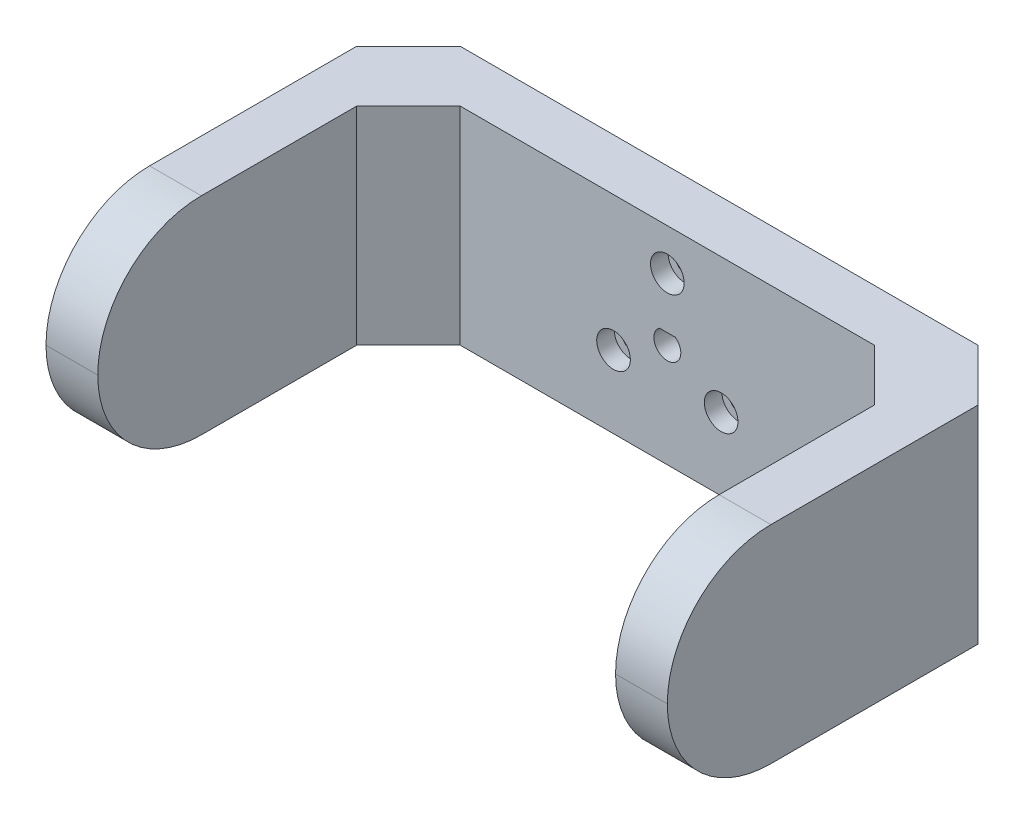
from build123d import *

# Parameters (mm, degrees)
AUFSATZ_LINEAR_AUSTRAGEN1_DEPTH = 20
SCHNITT_LINEAR_AUSTRAGEN1_DEPTH = 20
FASE1_SIZE                      = 10
VERRUNDUNG1_R                   = 20
SKIZZE3_R                       = 3.25
SCHNITT_LINEAR_AUSTRAGEN2_DEPTH = 3.4
SKIZZE4_R                       = 1.7
SCHNITT_LINEAR_AUSTRAGEN3_DEPTH = 6.6
KREISMUSTER1_COUNT              = 3


with BuildPart() as part:
    # Skizze1 → Aufsatz-Linear austragen1 (new, symmetric)
    with BuildSketch(Plane(origin=(0, 0, 0), x_dir=(1, 0, 0), z_dir=(0, 1, 0))):
        Polygon((-60, 0), (60, 0), (60, -70), (50, -70), (50, -10), (-50, -10), (-50, -70), (-60, -70), align=None)
    extrude(amount=AUFSATZ_LINEAR_AUSTRAGEN1_DEPTH, both=True)

    # Skizze2 → Schnitt-Linear austragen1 (cut)
    with BuildSketch(Plane(origin=(0, 0, 0), x_dir=(-1, 0, 0), z_dir=(0, 0, -1))):
        with BuildLine():
            Line((-1.532970972, 2.1), (1.532970972, 2.1))
            ThreePointArc((1.532970972, 2.1), (0, -2.6), (-1.532970972, 2.1))
        make_face()
    extrude(amount=-SCHNITT_LINEAR_AUSTRAGEN1_DEPTH, mode=Mode.SUBTRACT)

    # Fase1
    fase1_edges = [part.edges().sort_by_distance(p)[0] for p in [
        (-60, 0, 0),
        (60, 0, 0),
        (50, 0, 10),
        (-50, 0, 10),
    ]]
    chamfer(fase1_edges, length=FASE1_SIZE)

    # Verrundung1
    verrundung1_edges = [part.edges().sort_by_distance(p)[0] for p in [
        (-55, -20, 70),
        (-55, 20, 70),
        (55, 20, 70),
        (55, -20, 70),
    ]]
    fillet(verrundung1_edges, radius=VERRUNDUNG1_R - 0.0001)  # a hair under: the kernel refuses the full size

    # Skizze3 → Schnitt-Linear austragen2 (cut)
    with BuildSketch(Plane.XY.offset(10)):
        with Locations((0, 12)):
            Circle(SKIZZE3_R)
    schnitt_linear_austragen2 = extrude(amount=-SCHNITT_LINEAR_AUSTRAGEN2_DEPTH, mode=Mode.SUBTRACT)

    # Skizze4 → Schnitt-Linear austragen3 (cut)
    with BuildSketch(Plane.XY.offset(6.6)):
        with Locations((0, 12)):
            Circle(SKIZZE4_R)
    schnitt_linear_austragen3 = extrude(amount=-SCHNITT_LINEAR_AUSTRAGEN3_DEPTH, mode=Mode.SUBTRACT)

    # Kreismuster1: Schnitt-Linear austragen2, Schnitt-Linear austragen3 ×3 about axis
    kreismuster1_axis = Axis((0, 0, 0), (0, 0, 1))
    add([schnitt_linear_austragen2.rotate(kreismuster1_axis, i * 360 / KREISMUSTER1_COUNT) for i in range(1, KREISMUSTER1_COUNT)], mode=Mode.SUBTRACT)
    add([schnitt_linear_austragen3.rotate(kreismuster1_axis, i * 360 / KREISMUSTER1_COUNT) for i in range(1, KREISMUSTER1_COUNT)], mode=Mode.SUBTRACT)


solid = part.part
